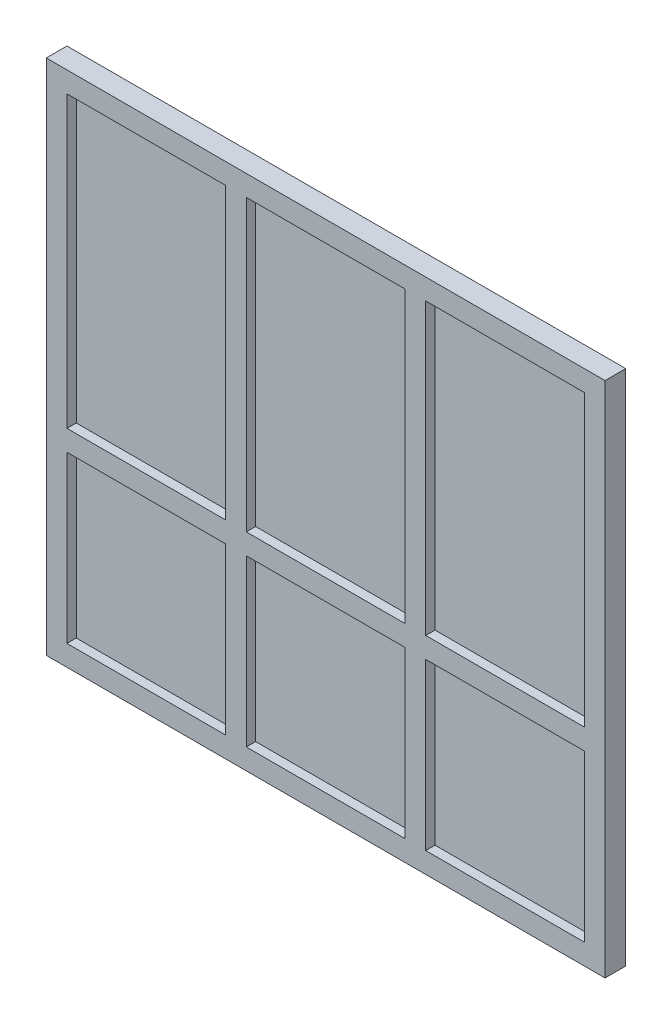
from build123d import *

# Parameters (mm, degrees)
SKETCH_1_W      = 2700
SKETCH_1_H      = 2500
SKETCH_1_W_2    = 766.666666667
SKETCH_1_H_2    = 1400
SKETCH_1_H_3    = 800
SKETCH_1_W_3    = 766.666666666
EXTRUDE_1_DEPTH = 100
SKETCH_2_W      = 2500
SKETCH_2_H      = 2300
EXTRUDE_2_DEPTH = 5


with BuildPart() as part:
    # Эскиз1 → Бобышка-Вытянуть1 (new body)
    with BuildSketch(Plane.XY):
        with Locations((35, 1250)):
            Rectangle(SKETCH_1_W, SKETCH_1_H)
        with Locations((-831.666666667, 1700)):
            Rectangle(SKETCH_1_W_2, SKETCH_1_H_2, mode=Mode.SUBTRACT)
        with Locations((-831.666666667, 500)):
            Rectangle(SKETCH_1_W_2, SKETCH_1_H_3, mode=Mode.SUBTRACT)
        with Locations((35, 1700)):
            Rectangle(SKETCH_1_W_3, SKETCH_1_H_2, mode=Mode.SUBTRACT)
        with Locations((35, 500)):
            Rectangle(SKETCH_1_W_3, SKETCH_1_H_3, mode=Mode.SUBTRACT)
        with Locations((901.666666667, 1700)):
            Rectangle(SKETCH_1_W_2, SKETCH_1_H_2, mode=Mode.SUBTRACT)
        with Locations((901.666666667, 500)):
            Rectangle(SKETCH_1_W_2, SKETCH_1_H_3, mode=Mode.SUBTRACT)
    extrude(amount=EXTRUDE_1_DEPTH)


with BuildPart() as body_2:
    # Эскиз2 → Бобышка-Вытянуть2 (new, symmetric)
    with BuildSketch(Plane(origin=(0, 0, 50), x_dir=(-1, 0, 0), z_dir=(0, 0, -1))):
        with Locations((-35, 1250)):
            Rectangle(SKETCH_2_W, SKETCH_2_H)
    extrude(amount=EXTRUDE_2_DEPTH, both=True)


solid = Compound([part.part, body_2.part])
